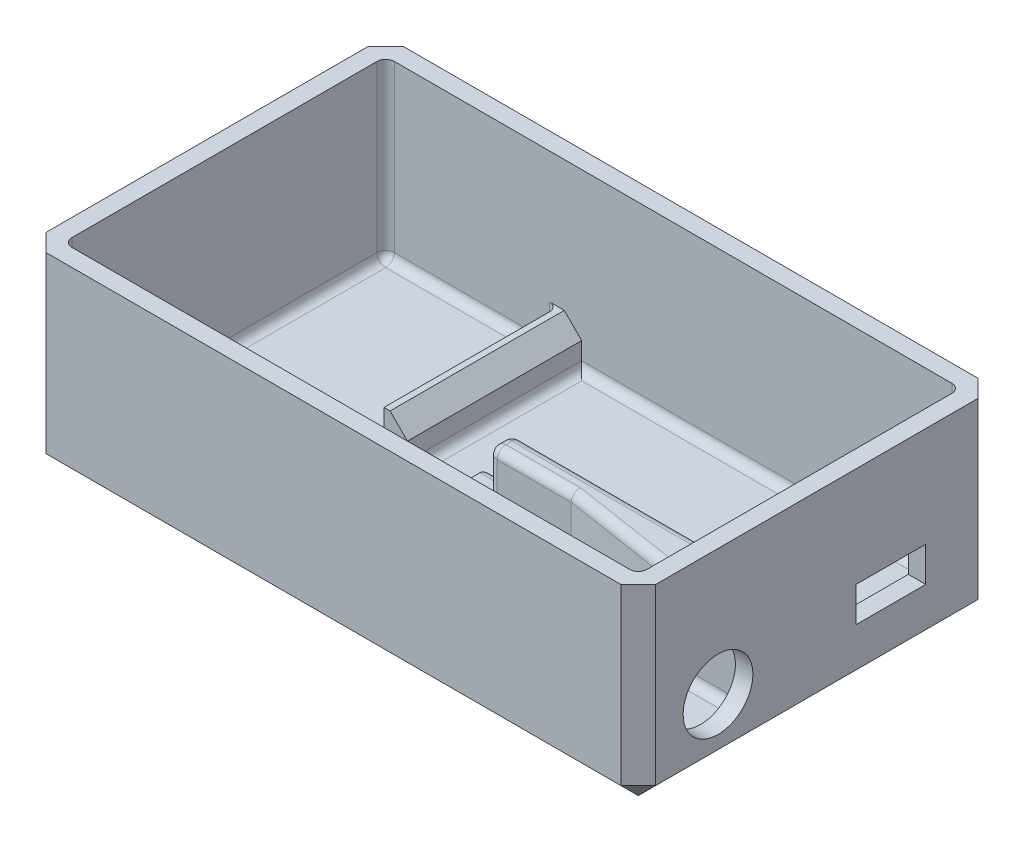
from build123d import *

# Parameters (mm, degrees)
ESQUISSE1_W             = 70
ESQUISSE1_H             = 41
BOSS_EXTRU_1_DEPTH      = 22
COQUE1_T                = -2
BOSS_EXTRU_2_DEPTH      = 10
ENL_V_MAT_EXTRU_1_REACH = 76.352
ESQUISSE3_R             = 4
ESQUISSE3_W             = 8
ESQUISSE3_H             = 4
ENL_V_MAT_EXTRU_2_REACH = 76.352
ESQUISSE4_R             = 3.5
ESQUISSE5_W             = 2.7
ESQUISSE5_H             = 20
ESQUISSE5_H_2           = 4.3
ESQUISSE5_H_3           = 1.6
BOSS_EXTRU_3_DEPTH      = 5
CONG_1_R                = 1
CHANFREIN1_SIZE         = 2


with BuildPart() as part:
    # Esquisse1 → Boss.-Extru.1 (new body)
    with BuildSketch(Plane(origin=(0, 0, 0), x_dir=(1, 0, 0), z_dir=(0, 1, 0))):
        Rectangle(ESQUISSE1_W, ESQUISSE1_H)
    extrude(amount=BOSS_EXTRU_1_DEPTH)

    # Coque1
    coque1_openings = [part.faces().sort_by_distance(p)[0] for p in [
        (0, 22, 0),
    ]]
    offset(amount=COQUE1_T, openings=coque1_openings, kind=Kind.INTERSECTION)

    # Esquisse2 → Boss.-Extru.2 (add)
    with BuildSketch(Plane(origin=(0, 2, 0), x_dir=(1, 0, 0), z_dir=(0, 1, 0))):
        Polygon((33, -16.5), (24, -16.5), (11, -18.5), (33, -18.5), align=None)
        Polygon((33, -6.2), (24, -6.2), (11, -4.2), (1.5, -4.2), (1.5, -1.5), (33, -1.5), align=None)
    extrude(amount=BOSS_EXTRU_2_DEPTH)

    # Esquisse3 → Enlèv. mat.-Extru.1 (cut, up to next)
    with BuildSketch(Plane.ZY.offset(-33), mode=Mode.PRIVATE) as enl_v_mat_extru_1_sk1:
        with Locations((11.35, 7.5)):
            Circle(ESQUISSE3_R)
    enl_v_mat_extru_1_tool1 = extrude(enl_v_mat_extru_1_sk1.sketch, amount=-ENL_V_MAT_EXTRU_1_REACH, mode=Mode.PRIVATE) & part.part
    # Esquisse3 → Enlèv. mat.-Extru.1 (cut, up to next)
    with BuildSketch(Plane.ZY.offset(-33), mode=Mode.PRIVATE) as enl_v_mat_extru_1_sk2:
        with Locations((-8.5, 8.5)):
            Rectangle(ESQUISSE3_W, ESQUISSE3_H)
    enl_v_mat_extru_1_tool2 = extrude(enl_v_mat_extru_1_sk2.sketch, amount=-ENL_V_MAT_EXTRU_1_REACH, mode=Mode.PRIVATE) & part.part
    add(enl_v_mat_extru_1_tool1.solids().sort_by_distance((33, 7.5, 11.35))[0], mode=Mode.SUBTRACT)
    add(enl_v_mat_extru_1_tool2.solids().sort_by_distance((33, 8.5, -8.5))[0], mode=Mode.SUBTRACT)

    # Esquisse4 → Enlèv. mat.-Extru.2 (cut, up to next)
    with BuildSketch(Plane(origin=(-33, 0, 0), x_dir=(0, 0, -1), z_dir=(1, 0, 0)), mode=Mode.PRIVATE) as enl_v_mat_extru_2_sk1:
        with Locations((-11.35, 7.5)):
            Circle(ESQUISSE4_R)
    enl_v_mat_extru_2_tool1 = extrude(enl_v_mat_extru_2_sk1.sketch, amount=-ENL_V_MAT_EXTRU_2_REACH, mode=Mode.PRIVATE) & part.part
    add(enl_v_mat_extru_2_tool1.solids().sort_by_distance((-33, 7.5, 11.35))[0], mode=Mode.SUBTRACT)

    # Esquisse5 → Boss.-Extru.3 (add)
    with BuildSketch(Plane(origin=(0, 2, 0), x_dir=(1, 0, 0), z_dir=(0, 1, 0))):
        with Locations((-11.85, 8.5)):
            Rectangle(ESQUISSE5_W, ESQUISSE5_H)
        with Locations((0.15, -3.65)):
            Rectangle(ESQUISSE5_W, ESQUISSE5_H_2)
        with Locations((0.15, -17.7)):
            Rectangle(ESQUISSE5_W, ESQUISSE5_H_3)
    extrude(amount=BOSS_EXTRU_3_DEPTH)

    # Congé1
    cong_1_edges = [part.edges().sort_by_distance(p)[0] for p in [
        (28.5, 12, 6.2),
        (17.5, 12, 5.2),
        (6.25, 12, 4.2),
        (17.25, 12, 1.5),
        (1.5, 9.5, 4.2),
        (1.5, 9.5, 1.5),
        (22, 12, 18.5),
        (33, 12, 17.5),
        (33, 12, 3.85),
        (33, 7, 1.5),
        (28.5, 2, 16.5),
        (33, 7, 16.5),
        (33, 7, 6.2),
        (33, 17, 18.5),
        (33, 12, -18.5),
        (33, 2, 11.35),
        (17.5, 2, 17.5),
        (28.5, 2, 6.2),
        (17.5, 2, 5.2),
        (6.25, 2, 4.2),
        (15.9, 2, 1.5),
        (33, 2, -8.5),
        (6.25, 2, 18.5),
        (-17.1, 2, 18.5),
        (-33, 12, 18.5),
        (-33, 2, 0),
        (-23.1, 2, -18.5),
        (11.25, 2, -18.5),
        (-33, 12, -18.5),
        (1.5, 12, 2.85),
        (-1.2, 2, 17.7),
        (1.5, 2, 17.7),
        (0.15, 2, 16.9),
        (1.5, 2, 5),
        (0.15, 2, 5.8),
        (-1.2, 2, 3.65),
        (-11.85, 2, 1.5),
        (-10.5, 2, -8.5),
        (-13.2, 2, -8.5),
        (0.15, 7, 1.5),
        (-13.2, 4.5, -18.5),
        (-1.2, 4.5, 18.5),
        (-1.2, 4.5, 1.5),
    ]]
    fillet(cong_1_edges, radius=CONG_1_R)

    # Chanfrein1
    chanfrein1_edges = [part.edges().sort_by_distance(p)[0] for p in [
        (0, 0, -20.5),
        (35, 11, -20.5),
        (35, 0, 0),
        (35, 11, 20.5),
        (0, 0, 20.5),
        (-35, 11, 20.5),
        (-35, 0, 0),
        (-35, 11, -20.5),
        (1.5, 7, 17.7),
        (1.5, 7, 5),
        (-10.5, 7, -8.5),
    ]]
    chamfer(chanfrein1_edges, length=CHANFREIN1_SIZE)


solid = part.part
